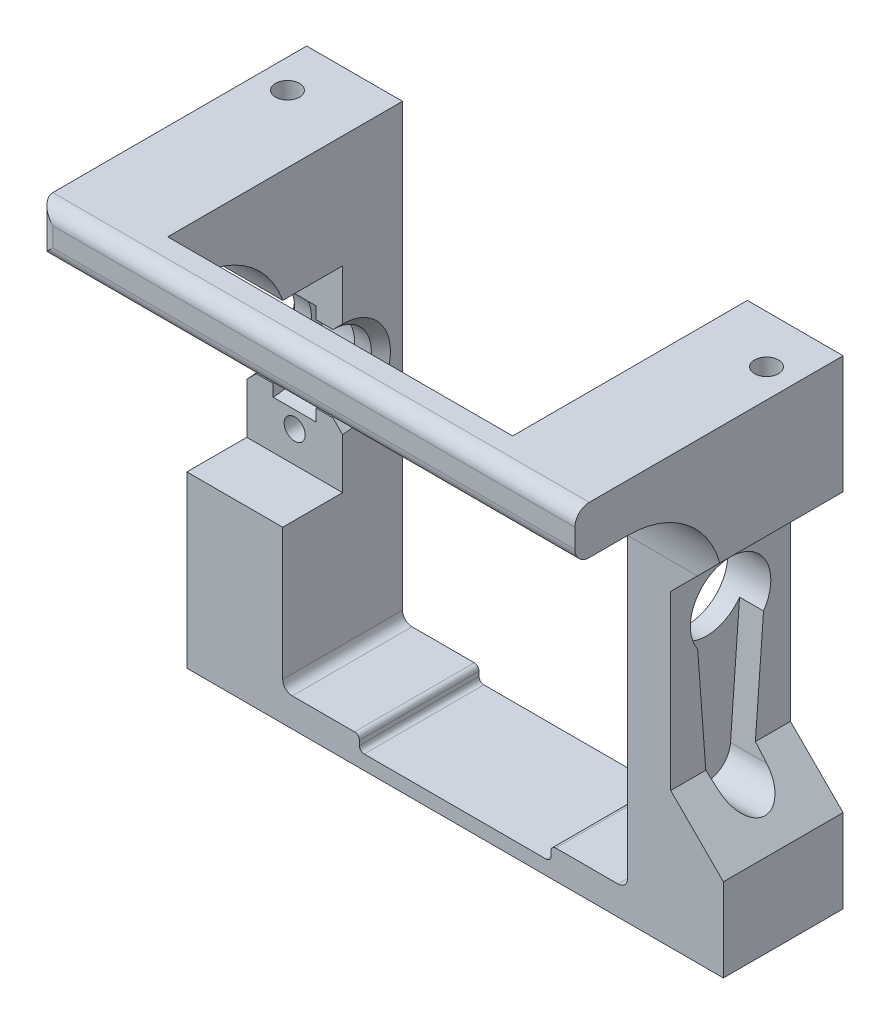
from build123d import *

# Parameters (mm, degrees)
SKETCH_1_W             = 56
SKETCH_1_H             = 50
EXTRUDE_487_DEPTH      = 12.5
SKETCH_3_W             = 36
SKETCH_3_H             = 46
CUT_EXTRUDE_730_DEPTH  = 40.563240514
SKETCH_11_R            = 1.25
CUT_EXTRUDE_984_DEPTH  = 10
CUT_EXTRUDE_1451_DEPTH = 8
CUT_EXTRUDE_1793_REACH = 64.588
SKETCH_4_R             = 4.2
SKETCH_6_R             = 4
CUT_EXTRUDE_1930_DEPTH = 10
SKETCH_7_W             = 6.25
SKETCH_7_H             = 20.5
CUT_EXTRUDE_2129_DEPTH = 10
SKETCH_8_R             = 5.25
CUT_EXTRUDE_2306_DEPTH = 2.25
SKETCH_9_R             = 1.1
CUT_EXTRUDE_2664_DEPTH = 5.25
CUT_EXTRUDE_3061_DEPTH = 40.563240514
CHAMFER_1_SIZE         = 1
FILLET_1_R             = 1
SKETCH_12_W            = 20
SKETCH_12_H            = 1.5
CUT_EXTRUDE_3473_DEPTH = 40.563240514
FILLET_2_R             = 0.5
CUT_EXTRUDE_4198_REACH = 41.563
SKETCH_13_W            = 36
SKETCH_13_H            = 1
EXTRUDE_4558_DEPTH     = 5
FILLET_3_R             = 10
FILLET_4_R             = 1.5


with BuildPart() as part:
    # Эскиз1 → Extrude 487 (new body)
    with BuildSketch(Plane.XY):
        Rectangle(SKETCH_1_W, SKETCH_1_H)
    extrude(amount=EXTRUDE_487_DEPTH)

    # Эскиз3 → Cut-Extrude 730 (cut, through all)
    with BuildSketch(Plane.XY.offset(12.5)):
        with Locations((0, 1)):
            Rectangle(SKETCH_3_W, SKETCH_3_H)
    extrude(amount=-CUT_EXTRUDE_730_DEPTH, mode=Mode.SUBTRACT)

    # Эскиз11 → Cut-Extrude 984 (cut)
    with BuildSketch(Plane.XZ.offset(25)):
        with Locations(Location((-25, 5, 0), (0, 0, 270))):
            Circle(SKETCH_11_R)
        with Locations(Location((25, 5, 0), (0, 0, 270))):
            Circle(SKETCH_11_R)
    cut_extrude_984 = extrude(amount=-CUT_EXTRUDE_984_DEPTH, mode=Mode.SUBTRACT)

    # Mirror 1028: Cut-Extrude 984 across plane
    add(cut_extrude_984.mirror(Plane.ZX), mode=Mode.SUBTRACT)

    # Эскиз5 → Cut-Extrude 1451 (cut)
    with BuildSketch(Plane(origin=(28, 0, 0), x_dir=(0, 0, -1), z_dir=(1, 0, 0))):
        with BuildLine():
            Line((-9.688027281, 0.587538929), (-8.743079599, -12.085887362))
            ThreePointArc((-8.743079599, -12.085887362), (-6.25, -14.4), (-3.756920401, -12.085887362))
            Line((-3.756920401, -12.085887362), (-2.811972719, 0.587538929))
            ThreePointArc((-2.811972719, 0.587538929), (-6.25, 7.2), (-9.688027281, 0.587538929))
        make_face()
    extrude(amount=-CUT_EXTRUDE_1451_DEPTH, mode=Mode.SUBTRACT)

    # Эскиз4 → Cut-Extrude 1793 (cut, up to next)
    with BuildSketch(Plane(origin=(28, 0, 0), x_dir=(0, 0, -1), z_dir=(1, 0, 0)), mode=Mode.PRIVATE) as cut_extrude_1793_sk1:
        with Locations((-6.25, 3)):
            Circle(SKETCH_4_R)
    cut_extrude_1793_tool1 = extrude(cut_extrude_1793_sk1.sketch, amount=-CUT_EXTRUDE_1793_REACH, mode=Mode.PRIVATE) & part.part
    add(cut_extrude_1793_tool1.solids().sort_by_distance((28, 3, 6.25))[0], mode=Mode.SUBTRACT)

    # Эскиз6 → Cut-Extrude 1930 (cut)
    with BuildSketch(Plane.ZY.offset(28)):
        with Locations((6.25, 3)):
            Circle(SKETCH_6_R)
    extrude(amount=-CUT_EXTRUDE_1930_DEPTH, mode=Mode.SUBTRACT)

    # Эскиз7 → Cut-Extrude 2129 (cut)
    with BuildSketch(Plane.ZY.offset(28)):
        with Locations((9.375, 3)):
            Rectangle(SKETCH_7_W, SKETCH_7_H)
    extrude(amount=-CUT_EXTRUDE_2129_DEPTH, mode=Mode.SUBTRACT)

    # Эскиз8 → Cut-Extrude 2306 (cut, symmetric)
    with BuildSketch(Plane.ZY.offset(23)):
        with Locations((6.25, 3)):
            Circle(SKETCH_8_R)
    extrude(amount=CUT_EXTRUDE_2306_DEPTH, both=True, mode=Mode.SUBTRACT)

    # Эскиз9 → Cut-Extrude 2664 (cut)
    with BuildSketch(Plane.XY.offset(6.25)):
        with Locations((-23, 10)):
            Circle(SKETCH_9_R)
        with Locations((-23, -4)):
            Circle(SKETCH_9_R)
    extrude(amount=-CUT_EXTRUDE_2664_DEPTH, mode=Mode.SUBTRACT)

    # Эскиз10 → Cut-Extrude 3061 (cut, through all)
    with BuildSketch(Plane.XY.offset(12.5)):
        Polygon((28, -16.3), (28, 12.7), (22.5, 7.2), (22.5, -10.8), align=None)
    extrude(amount=-CUT_EXTRUDE_3061_DEPTH, mode=Mode.SUBTRACT)

    # Фаска1
    chamfer_1_edges = [part.edges().sort_by_distance(p)[0] for p in [
        (-28, 3, 2.25),
        (-18, 3, 2.25),
    ]]
    chamfer(chamfer_1_edges, length=CHAMFER_1_SIZE)

    # Скругление1
    fillet_1_edges = [part.edges().sort_by_distance(p)[0] for p in [
        (18, -22, 6.25),
        (-18, -22, 6.25),
    ]]
    fillet(fillet_1_edges, radius=FILLET_1_R)

    # Эскиз12 → Cut-Extrude 3473 (cut, through all)
    with BuildSketch(Plane.XY):
        with Locations((0, -22.75)):
            Rectangle(SKETCH_12_W, SKETCH_12_H)
    extrude(amount=CUT_EXTRUDE_3473_DEPTH, mode=Mode.SUBTRACT)

    # Скругление2
    fillet_2_edges = [part.edges().sort_by_distance(p)[0] for p in [
        (-10, -22, 6.25),
        (-10, -23.5, 6.25),
        (10, -23.5, 6.25),
        (10, -22, 6.25),
    ]]
    fillet(fillet_2_edges, radius=FILLET_2_R)

    # Эскиз13 → Cut-Extrude 4198 (cut, up to next)
    with BuildSketch(Plane.XY.offset(12.5), mode=Mode.PRIVATE) as cut_extrude_4198_sk1:
        with Locations((0, 24.5)):
            Rectangle(SKETCH_13_W, SKETCH_13_H)
    cut_extrude_4198_tool1 = extrude(cut_extrude_4198_sk1.sketch, amount=-CUT_EXTRUDE_4198_REACH, mode=Mode.PRIVATE) & part.part
    add(cut_extrude_4198_tool1.solids().sort_by_distance((0, 24.5, 12.5))[0], mode=Mode.SUBTRACT)

    # Эскиз14 → Extrude 4558 (add)
    with BuildSketch(Plane(origin=(0, 25, 0), x_dir=(1, 0, 0), z_dir=(0, 1, 0))):
        Polygon((-28, -12.5), (-28, -28), (28, -28), (28, -12.5), (18, -12.5), (18, -24.5), (-18, -24.5), (-18, -12.5), align=None)
    extrude(amount=-EXTRUDE_4558_DEPTH)

    # Скругление3
    # the kernel refuses this fillet: 10 mm, written as the material it adds along each edge
    with BuildSketch(Plane(origin=(28, 20, 12.5), x_dir=(0, -1, 0), z_dir=(-1, 0, 0))) as fillet_3_piece_1_section:
        with BuildLine():
            CenterArc((FILLET_3_R, FILLET_3_R), FILLET_3_R, 180, 90)
            Line((0, FILLET_3_R), (0, 0))
            Line((0, 0), (FILLET_3_R, 0))
        make_face()
    fillet_3_piece_1 = extrude(amount=10, mode=Mode.PRIVATE)
    fillet_3_piece_1 = split(fillet_3_piece_1, bisect_by=Plane(origin=(31.65, 16.35, 12.5), z_dir=(-0.7071067811865515, 0.7071067811865436, 0)), keep=Keep.TOP, mode=Mode.PRIVATE)
    add(fillet_3_piece_1)
    with BuildSketch(Plane(origin=(-18, 20, 12.5), x_dir=(0, -1, 0), z_dir=(-1, 0, 0))) as fillet_3_piece_2:
        with BuildLine():
            CenterArc((10, 9.45714016), FILLET_3_R, 180, 71.034425011)
            Line((0, 9.45714016), (0, 0))
            Line((0, 0), (6.75, 0))
        make_face()
    extrude(amount=10)

    # Скругление4
    fillet_4_edges = [part.edges().sort_by_distance(p)[0] for p in [
        (0, 20, 24.5),
        (0, 20, 28),
        (-28, 22.5, 28),
        (0, 25, 28),
    ]]
    fillet(fillet_4_edges, radius=FILLET_4_R)


solid = part.part
